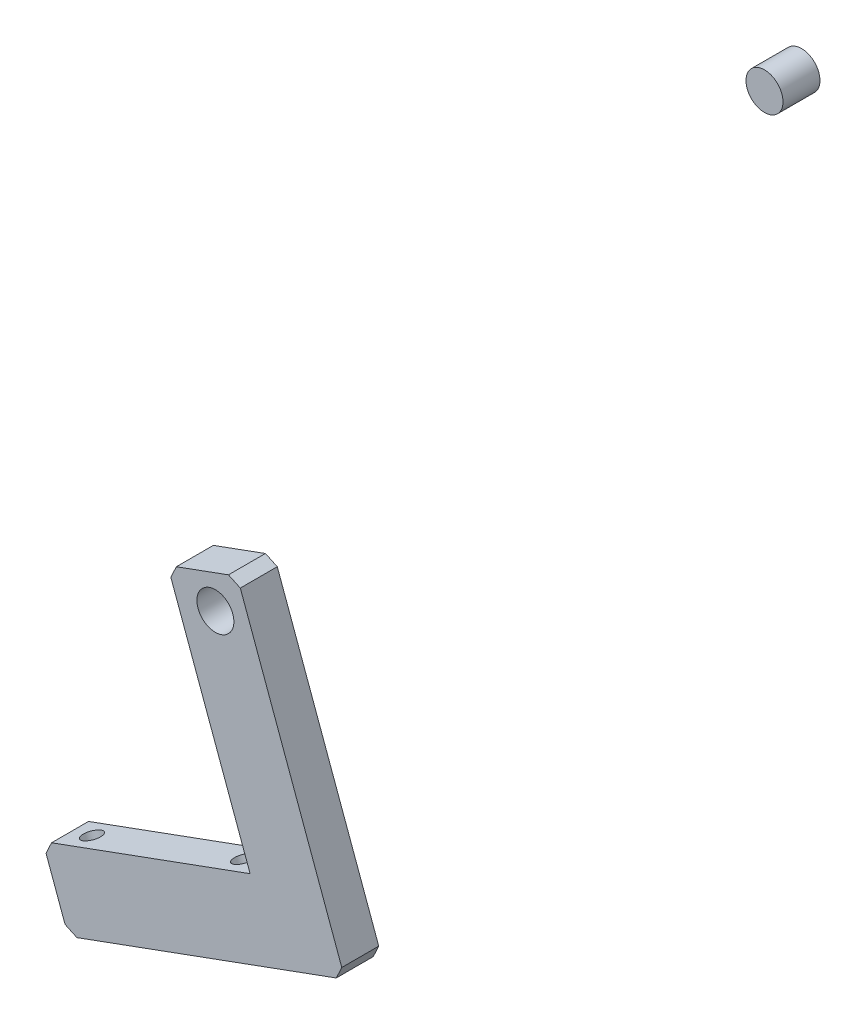
from build123d import *

# Parameters (mm, degrees)
SKETCH_1_R          = 5
EXTRUDE_1_DEPTH     = 10
EXTRUDE_1_2_DEPTH   = 10
SKETCH_2_R          = 2.5
CUT_EXTRUDE_2_DEPTH = 264.231529543
CHAMFER_1_SIZE      = 2.5


with BuildPart() as part:
    # 草圖1 → 填料-伸長1 (new body)
    with BuildSketch(Plane.XY):
        with Locations((112.659029384, 194.65047579)):
            Circle(SKETCH_1_R)
    extrude(amount=EXTRUDE_1_DEPTH)


with BuildPart() as body_2:
    # 草圖1 → Extrude 1 2 (new body)
    with BuildSketch(Plane.XY):
        Polygon((-29.956118011, 9.755168573), (-48.742646001, 2.894675435), (-26.446043305, -58.161540532), (-82.490240349, -78.627846462), (-75.629747212, -97.414374452), (-0.799022178, -70.087575384), align=None)
        with Locations((-35.835723415, -1.346100652)):
            Circle(SKETCH_1_R, mode=Mode.SUBTRACT)
    extrude(amount=EXTRUDE_1_2_DEPTH)

    # 草圖2 → 除料-伸長2 (cut, through all)
    with BuildSketch(Plane(origin=(15.628555148, -42.796674065, 0), x_dir=(0.9393263994919209, 0.3430246568652819, 0), z_dir=(-0.3430246568652819, 0.939326399491921, 0))):
        with Locations((-95.671540667, -4.982155923)):
            Circle(SKETCH_2_R)
        with Locations((-52.126292594, -4.982155923)):
            Circle(SKETCH_2_R)
    extrude(amount=-CUT_EXTRUDE_2_DEPTH, mode=Mode.SUBTRACT)

    # 導角1
    chamfer_1_edges = [body_2.edges().sort_by_distance(p)[0] for p in [
        (-29.956118011, 9.755168573, 5),
        (-48.742646001, 2.894675435, 5),
        (-0.799022178, -70.087575384, 5),
        (-75.629747212, -97.414374452, 5),
        (-82.490240349, -78.627846462, 5),
    ]]
    chamfer(chamfer_1_edges, length=CHAMFER_1_SIZE)


solid = Compound([part.part, body_2.part])
